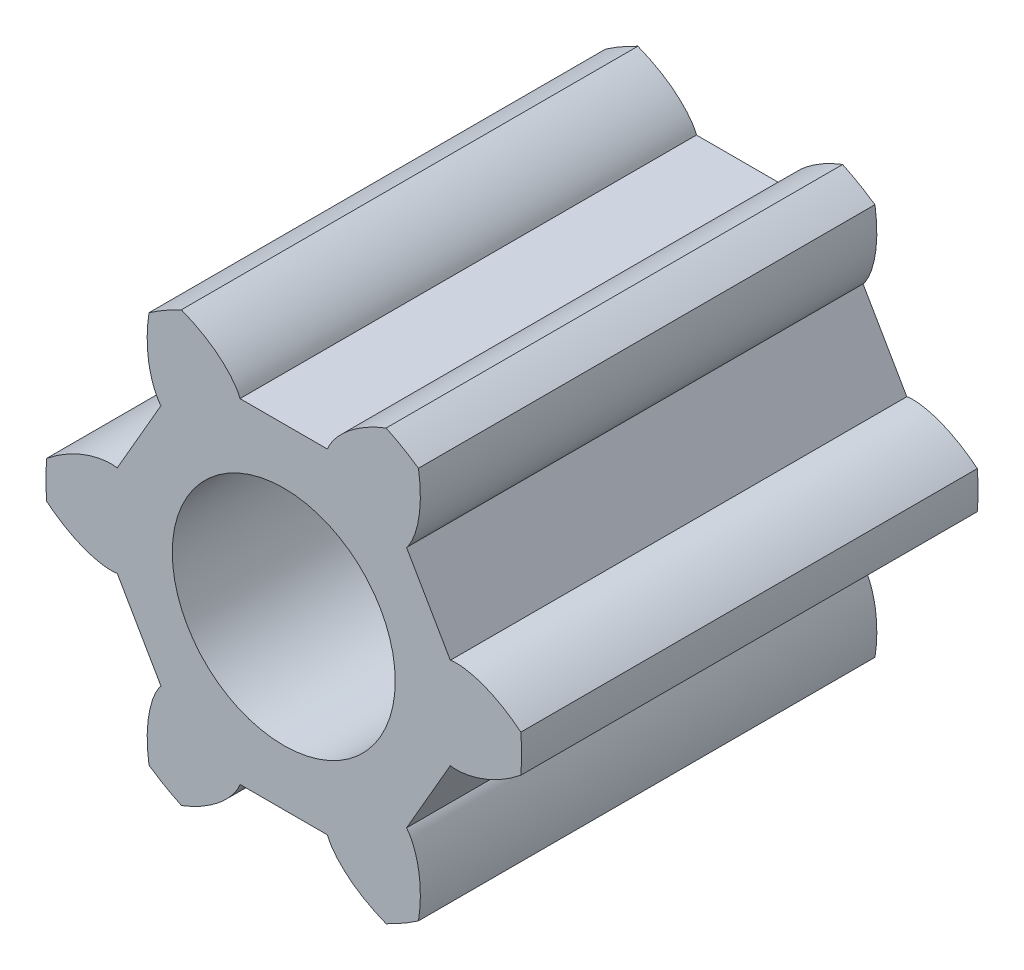
from build123d import *

# Parameters (mm, degrees)
SKETCH1_R               = 3.386666667
BOSS_EXTRUDE1_DEPTH     = 6.5
CUT_EXTRUDE2_DEPTH      = 8.5
CUT_EXTRUDE2_DEPTH_BACK = 8.5
SKETCH2_R               = 1.5875
CUT_EXTRUDE4_DEPTH      = 7.5
CIRPATTERN1_COUNT       = 6


with BuildPart() as part:
    # Sketch1 → Boss-Extrude1 (new body)
    with BuildSketch(Plane.XY):
        Circle(SKETCH1_R)
    extrude(amount=BOSS_EXTRUDE1_DEPTH)

    # Sketch2 → Cut-Extrude2 (cut, two sides: drawn at the far end of the back side and taken through both)
    with BuildSketch(Plane.XY.offset(-CUT_EXTRUDE2_DEPTH_BACK)):
        Circle(SKETCH2_R)
    extrude(amount=CUT_EXTRUDE2_DEPTH + CUT_EXTRUDE2_DEPTH_BACK, mode=Mode.SUBTRACT)

    # Sketch3 → Cut-Extrude4 (cut, symmetric)
    with BuildSketch(Plane.XY):
        with BuildLine():
            add(Edge.make_bspline(
                [(2.371737798, 0.649621457), (2.373318698, 0.650020598), (2.377776453, 0.651041764), (2.391690023, 0.653559625), (2.419461387, 0.656718431), (2.454074104, 0.658004394), (2.494026721, 0.656975291), (2.532614502, 0.65400575), (2.56558919, 0.650242629), (2.598432341, 0.645352701), (2.631081714, 0.639458284), (2.670514268, 0.631115312), (2.717612757, 0.619440679), (2.772297712, 0.603382875), (2.833813178, 0.58233816), (2.895831695, 0.557904672), (2.95625863, 0.531419706), (3.016494585, 0.501905369), (3.074187033, 0.47139734), (3.133119229, 0.436958887), (3.187023127, 0.403762763), (3.246174534, 0.363604952), (3.293560141, 0.330322515), (3.341382547, 0.293525651), (3.364487192, 0.275262974), (3.376221411, 0.265781954)],
                knots=[5e-09, 5e-09, 5e-09, 5e-09, 5e-09, 0.005376748, 0.015083688, 0.046610139, 0.092110525, 0.119476175, 0.146842495, 0.174208853, 0.201574955, 0.228941013, 0.256307345, 0.307035032, 0.361767351, 0.41649966, 0.471231936, 0.525964281, 0.580696615, 0.635428982, 0.690161387, 0.744893688, 0.799626083, 0.854358408, 0.909090924, 0.909090924, 0.909090924, 0.909090924, 0.909090924], degree=4))
            add(Edge.make_bspline(
                [(3.376221411, 0.265781954), (4.305585949, 0.33894312), (6.160970001, 0.485002138), (10.512824393, 0.827587589), (13.892186234, 1.093616757), (18.490559901, 1.455608628), (21.852101555, 1.72023496), (25.410351274, 2.000346488), (28.390806055, 2.234973007), (31.357463584, 2.468513382), (34.289867039, 2.699357218), (37.21519097, 2.929643741), (39.916349403, 3.142283571), (42.514652336, 3.34682644), (44.827824749, 3.528923345), (47.063741315, 3.704938536), (49.239212764, 3.876195385), (51.172063539, 4.028352717), (53.007708408, 4.172857833), (54.474319885, 4.288312007), (56.122097882, 4.418027921), (57.309899698, 4.51153372), (58.845934659, 4.632453029), (59.495617077, 4.683597145), (59.814826762, 4.70872588)],
                knots=[0.083333333, 0.083333333, 0.083333333, 0.083333333, 0.083333333, 0.149200626, 0.214066316, 0.274925595, 0.336786477, 0.387725122, 0.432177198, 0.474125267, 0.519125839, 0.559023008, 0.607791514, 0.645423153, 0.679429945, 0.712244353, 0.744224092, 0.778159341, 0.80653808, 0.828716422, 0.849130037, 0.870287698, 0.894043167, 0.916666667, 0.916666667, 0.916666667, 0.916666667, 0.916666667], degree=4))
            add(Edge.make_bspline(
                [(59.814826762, 4.70872588), (59.804432085, 4.840769207), (59.782445474, 5.105757726), (59.729834191, 5.709696728), (59.67208832, 6.271568674), (59.599867709, 6.931500504), (59.524056406, 7.551262076), (59.440292936, 8.186294028), (59.350381747, 8.813726068), (59.229407069, 9.600026567), (59.071047134, 10.540010373), (58.866874199, 11.634082662), (58.607137094, 12.878739961), (58.321056614, 14.117867256), (58.008799657, 15.350515807), (57.585899212, 16.882796799), (57.026636329, 18.706592102), (56.299312999, 20.810288765), (55.366998135, 23.177093923), (54.335183606, 25.502311276), (53.205849462, 27.781663924), (51.980824259, 30.01120296), (50.662632252, 32.186696395), (49.253111272, 34.304603681), (47.755663867, 36.36052042), (46.171543532, 38.351741972), (44.505982156, 40.273050799), (42.757922962, 42.12377881), (41.165304074, 43.674119695), (39.747624485, 44.958255382), (38.547214452, 45.987304612), (37.550335534, 46.803114638), (36.577486411, 47.569798862), (35.639245239, 48.271870167), (34.949363673, 48.774641686), (34.311292711, 49.221368877), (34.094445209, 49.3717728), (33.985289672, 49.446796519)],
                knots=[0.083333331, 0.083333331, 0.083333331, 0.083333331, 0.083333331, 0.093253966, 0.103174601, 0.113095236, 0.123015871, 0.132936506, 0.142857141, 0.152777776, 0.162698411, 0.182539681, 0.202380951, 0.222222221, 0.242063491, 0.261904761, 0.281746031, 0.32142857, 0.36111111, 0.40079365, 0.44047619, 0.48015873, 0.51984127, 0.55952381, 0.59920635, 0.63888889, 0.67857143, 0.718253969, 0.757936509, 0.797619049, 0.817460319, 0.837301589, 0.857142859, 0.876984129, 0.896825399, 0.906746034, 0.916666669, 0.916666669, 0.916666669, 0.916666669, 0.916666669], degree=4))
            add(Edge.make_bspline(
                [(33.985289672, 49.446796519), (33.788965986, 49.161155953), (33.371832607, 48.554248979), (32.367466483, 47.092949463), (31.385531456, 45.664286004), (29.9621637, 43.593361304), (28.744853957, 41.8222401), (27.391246254, 39.852812583), (26.154132289, 38.052877285), (24.926101314, 36.266157256), (23.587450131, 34.318490683), (22.202555719, 32.303542661), (20.773360841, 30.224139807), (19.255204926, 28.015303356), (17.752325461, 25.828693331), (16.039258619, 23.336271804), (14.339058641, 20.862570884), (12.286717936, 17.876523855), (10.380119121, 15.102523558), (7.79619577, 11.343051933), (5.942126156, 8.645478841), (3.472274437, 5.0519754), (2.435792265, 3.543948734), (1.918284634, 2.791002539)],
                knots=[0.083333333, 0.083333333, 0.083333333, 0.083333333, 0.083333333, 0.107822516, 0.134865785, 0.16413762, 0.204326923, 0.242901142, 0.269865118, 0.300063435, 0.335536859, 0.368815104, 0.410356571, 0.442858574, 0.485376603, 0.524889824, 0.569260817, 0.616561498, 0.669471154, 0.726011619, 0.787560096, 0.852113381, 0.916666667, 0.916666667, 0.916666667, 0.916666667, 0.916666667], degree=4))
            add(Edge.make_bspline(
                [(1.748457587, 1.729174462), (1.749593703, 1.73034399), (1.752706936, 1.733693936), (1.761844253, 1.744484511), (1.778465541, 1.766955815), (1.796885576, 1.796288325), (1.815970655, 1.831402858), (1.832692848, 1.866305628), (1.845921234, 1.896744105), (1.858108007, 1.927632072), (1.869327979, 1.958854467), (1.88181903, 1.997175547), (1.895257746, 2.043801351), (1.908693758, 2.099188814), (1.921226233, 2.162985127), (1.93107547, 2.228911482), (1.938352284, 2.294485226), (1.942910096, 2.361408262), (1.945335592, 2.426625402), (1.944977115, 2.494881407), (1.943180378, 2.558161614), (1.937978396, 2.629467141), (1.932847764, 2.687145499), (1.924891948, 2.74695935), (1.920628328, 2.776099897), (1.918284634, 2.791002539)],
                knots=[0, 0, 0, 0, 0, 0.005376748, 0.015083688, 0.046610139, 0.092110525, 0.119476175, 0.146842495, 0.174208853, 0.201574955, 0.228941013, 0.256307345, 0.307035032, 0.361767351, 0.41649966, 0.471231936, 0.525964281, 0.580696615, 0.635428982, 0.690161387, 0.744893688, 0.799626083, 0.854358408, 0.909090916, 0.909090916, 0.909090916, 0.909090916, 0.909090916], degree=4))
            add(Edge.make_bspline(
                [(1.748457587, 1.729174462), (1.754172713, 1.719275573), (1.765284259, 1.70002981), (1.791720577, 1.654240763), (1.813907271, 1.615812282), (1.84452031, 1.562788944), (1.870466262, 1.517849236), (1.898944101, 1.468524173), (1.924903905, 1.423560473), (1.952155373, 1.376359547), (1.978314661, 1.33105033), (2.007880096, 1.279841493), (2.037734323, 1.228132456), (2.068702007, 1.174494854), (2.100409738, 1.119575453), (2.131849297, 1.06512054), (2.164254695, 1.008992744), (2.195050331, 0.955653137), (2.228047744, 0.898499942), (2.256569954, 0.849098024), (2.292941193, 0.78610119), (2.3169762, 0.744471337), (2.351372045, 0.684895986), (2.364900463, 0.661464078), (2.371737798, 0.649621457)],
                knots=[0.083333333, 0.083333333, 0.083333333, 0.083333333, 0.083333333, 0.120011065, 0.156275438, 0.187738477, 0.229519612, 0.266865079, 0.306166056, 0.333066239, 0.372247978, 0.410428114, 0.447296627, 0.490604014, 0.531979739, 0.576487459, 0.61585203, 0.660542582, 0.702228327, 0.746441926, 0.783596612, 0.827285562, 0.872786935, 0.916666667, 0.916666667, 0.916666667, 0.916666667, 0.916666667], degree=4))
        make_face()
    cut_extrude4 = extrude(amount=CUT_EXTRUDE4_DEPTH, both=True, mode=Mode.SUBTRACT)

    # CirPattern1: Cut-Extrude4 ×6 about axis
    cirpattern1_axis = Axis((0, 0, -0.325), (0, 0, 1))
    for i in range(1, CIRPATTERN1_COUNT):
        add(cut_extrude4.rotate(cirpattern1_axis, i * 360 / CIRPATTERN1_COUNT), mode=Mode.SUBTRACT)


solid = part.part
